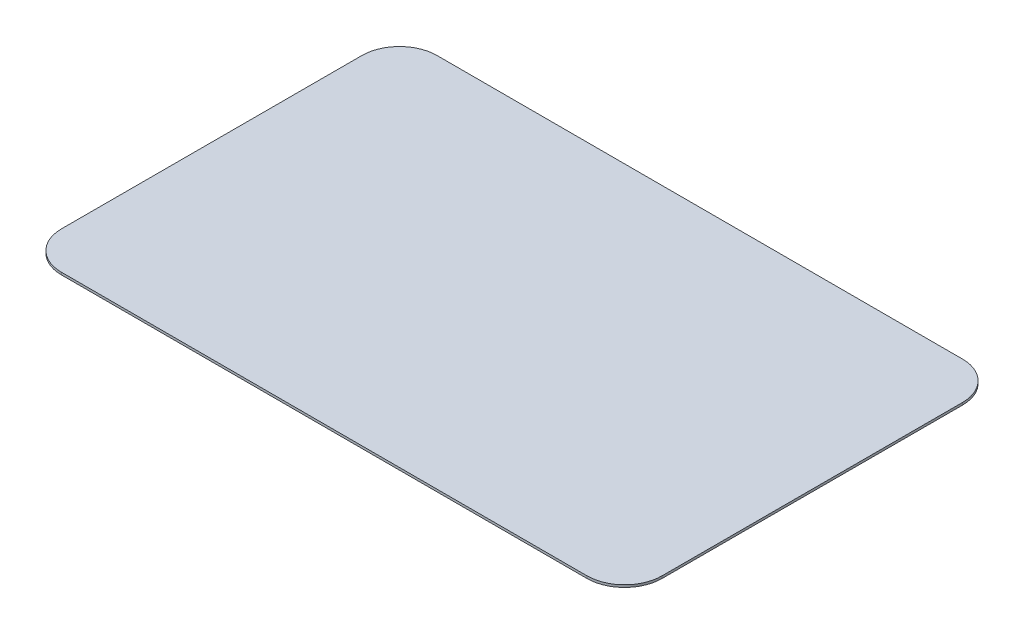
from build123d import *

# Parameters (mm, degrees)
MAINBODY_DEPTH = 0.79375


with BuildPart() as part:
    # Sketch1 → MainBody (new body)
    with BuildSketch(Plane(origin=(0, -26.084806156, 0), x_dir=(-1, 0, 0), z_dir=(0, -1, 0))):
        with BuildLine():
            Line((-151.559604344, 85.532652405), (-151.529220663, -16.067343052))
            ThreePointArc((-151.529220663, -16.067343052), (-147.806791387, -25.046486374), (-138.825423271, -28.763544524))
            Line((-138.825423271, -28.763544524), (38.974568779, -28.710373083))
            ThreePointArc((38.974568779, -28.710373083), (47.953712101, -24.987943807), (51.670770251, -16.006575691))
            Line((51.670770251, -16.006575691), (51.64038657, 85.593419766))
            ThreePointArc((51.64038657, 85.593419766), (47.917957294, 94.572563089), (38.936589178, 98.289621238))
            Line((38.936589178, 98.289621238), (-138.863402872, 98.236449797))
            ThreePointArc((-138.863402872, 98.236449797), (-147.842546194, 94.514020521), (-151.559604344, 85.532652405))
        make_face()
    extrude(amount=MAINBODY_DEPTH)


solid = part.part
